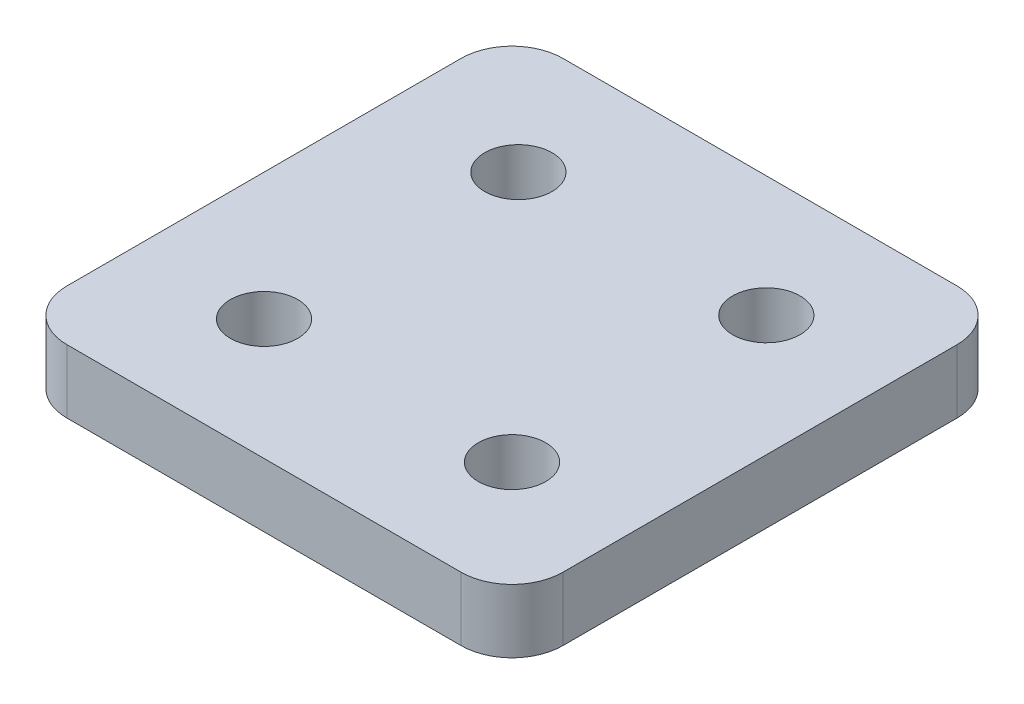
from build123d import *

# Parameters (mm, degrees)
F_4_HOLE_PROFILE_SKETCH_R        = 2.65
F_4_HOLE_THICKNESS_EXTRUDE_DEPTH = 5


with BuildPart() as part:
    # 4 Hole Profile Sketch → 4 Hole Thickness Extrude (new body)
    with BuildSketch(Plane(origin=(0, 0, 0), x_dir=(1, 0, 0), z_dir=(0, 1, 0))):
        with BuildLine():
            Line((-15.5, -19.5), (15.5, -19.5))
            ThreePointArc((15.5, -19.5), (18.328427125, -18.328427125), (19.5, -15.5))
            Line((19.5, -15.5), (19.5, 15.5))
            ThreePointArc((19.5, 15.5), (18.328427125, 18.328427125), (15.5, 19.5))
            Line((15.5, 19.5), (-15.5, 19.5))
            ThreePointArc((-15.5, 19.5), (-18.328427125, 18.328427125), (-19.5, 15.5))
            Line((-19.5, 15.5), (-19.5, -15.5))
            ThreePointArc((-19.5, -15.5), (-18.328427125, -18.328427125), (-15.5, -19.5))
        make_face()
        with Locations((10, -10)):
            Circle(F_4_HOLE_PROFILE_SKETCH_R, mode=Mode.SUBTRACT)
        with Locations((10, 10)):
            Circle(F_4_HOLE_PROFILE_SKETCH_R, mode=Mode.SUBTRACT)
        with Locations((-9.5, -10)):
            Circle(F_4_HOLE_PROFILE_SKETCH_R, mode=Mode.SUBTRACT)
        with Locations((-9.5, 10)):
            Circle(F_4_HOLE_PROFILE_SKETCH_R, mode=Mode.SUBTRACT)
    extrude(amount=F_4_HOLE_THICKNESS_EXTRUDE_DEPTH)


solid = part.part
